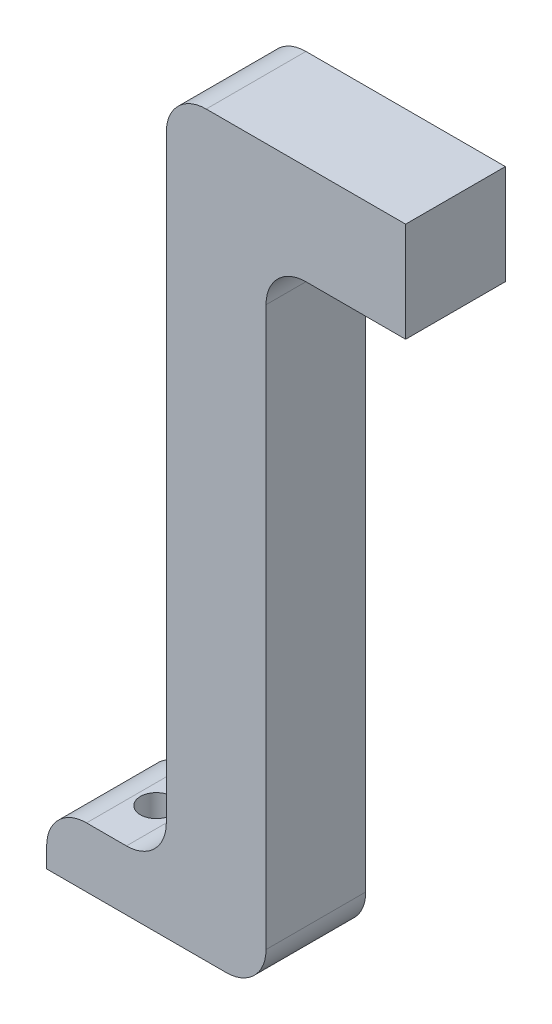
from build123d import *

# Parameters (mm, degrees)
BOSS_EXTRUDE1_DEPTH        = 0.625
BOSS_EXTRUDE1_DEPTH_BACK   = 0.625
FILLET1_R                  = 0.5
F_0_4_0_4_DIAMETER_HOLE1_D = 0.4


with BuildPart() as part:
    # Sketch1 → Boss-Extrude1 (new, two sides: drawn at the far end of the back side and taken through both)
    with BuildSketch(Plane.XY.offset(-BOSS_EXTRUDE1_DEPTH_BACK)):
        Polygon((-0.214230565, -7.75), (-0.214230565, 0.25), (1.535769435, 0.25), (1.535769435, 1.5), (-1.464230565, 1.5), (-1.464230565, -7), (-2.964230565, -7), (-2.964230565, -7.75), align=None)
    extrude(amount=BOSS_EXTRUDE1_DEPTH + BOSS_EXTRUDE1_DEPTH_BACK)

    # Fillet1
    fillet1_edges = [part.edges().sort_by_distance(p)[0] for p in [
        (-0.214230565, 0.25, 0),
        (-1.464230565, 1.5, 0),
        (-2.964230565, -7, 0),
        (-0.214230565, -7.75, 0),
        (-1.464230565, -7, 0),
    ]]
    fillet(fillet1_edges, radius=FILLET1_R)

    # Ø0.4 (0.4) Diameter Hole1 (through all)
    with Locations(Plane(origin=(0, -7, 0), x_dir=(1, 0, 0), z_dir=(0, 1, 0))):
        with Locations((-2.214230565, 0)):
            Hole(F_0_4_0_4_DIAMETER_HOLE1_D / 2)


solid = part.part
